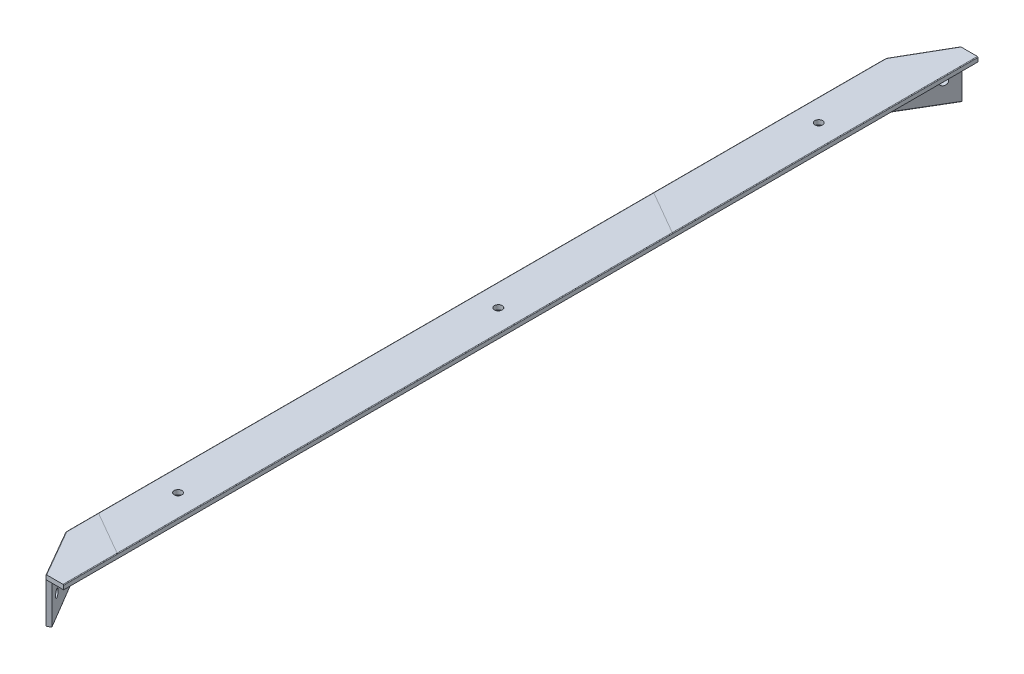
from build123d import *
from build123d.topology import SkipClean

# Parameters (mm, degrees)
BOSS_EXTRUDE1_DEPTH = 640
SKETCH22_R          = 6
CUT_EXTRUDE4_DEPTH  = 10
BOSS_EXTRUDE2_DEPTH = 63
BOSS_EXTRUDE3_DEPTH = 7
SKETCH26_R          = 6
CUT_EXTRUDE5_DEPTH  = 7
FILLET1_R           = 10
FILLET2_R           = 10
FILLET3_R           = 5
FILLET5_R           = 1


with BuildPart() as part:
    # Sketch1 → Boss-Extrude1 (new body)
    with BuildSketch(Plane.XY):
        Polygon((0, 0), (0, 70), (70, 70), (70, 63), (7, 63), (7, 0), align=None)
    extrude(amount=BOSS_EXTRUDE1_DEPTH)

    # Sketch22 → Cut-Extrude4 (cut)
    with BuildSketch(Plane(origin=(0, 70, 0), x_dir=(1, 0, 0), z_dir=(0, 1, 0))):
        with Locations((35, 0)):
            Circle(SKETCH22_R)
        with Locations((35, 500)):
            Circle(SKETCH22_R)
        with Locations((35, -500)):
            Circle(SKETCH22_R)
    extrude(amount=-CUT_EXTRUDE4_DEPTH, mode=Mode.SUBTRACT)

    # Sketch23 → Boss-Extrude2 (add)
    with BuildSketch(Plane(origin=(0, 0, 0), x_dir=(1, 0, 0), z_dir=(0, 1, 0))):
        Polygon((0, -640), (42.5, -713.612159322), (48.562177826, -710.112159322), (7, -640), align=None)
    extrude(amount=BOSS_EXTRUDE2_DEPTH)

    # Sketch25 → Boss-Extrude3 (add)
    with BuildSketch(Plane(origin=(0, 63, 0), x_dir=(1, 0, 0), z_dir=(0, 1, 0))):
        Polygon((70, -640), (0, -640), (42.5, -713.612159322), (70, -713.612159322), align=None)
    extrude(amount=BOSS_EXTRUDE3_DEPTH)

    # Sketch26 → Cut-Extrude5 (cut)
    with BuildSketch(Plane(origin=(-275.556719825, 0, 163.348804279), x_dir=(-0.5099316128113042, 0, -0.8602149442178172), z_dir=(0.8602149442178172, 0, -0.5099316128113042))):
        with Locations((-614.36248118, 31.5)):
            Circle(SKETCH26_R)
        with Locations((-575.367085589, 31.5)):
            Circle(SKETCH26_R)
    extrude(amount=-CUT_EXTRUDE5_DEPTH, mode=Mode.SUBTRACT)

    # Mirror1: part across plane


with BuildPart() as part_1:
    with SkipClean():  # the faces are left unmerged after this step: merging them gives an invalid solid
        add(part.part)
        add(part.part.mirror(Plane.XY))

    # Fillet1
    fillet1_edges = [part_1.edges().sort_by_distance(p)[0] for p in [
        (0, 35, -640),
        (0, 35, 640),
    ]]
    fillet(fillet1_edges, radius=FILLET1_R)

    # Fillet2
    fillet2_edges = [part_1.edges().sort_by_distance(p)[0] for p in [
        (7, 31.5, 640),
        (7, 31.5, -640),
    ]]
    fillet(fillet2_edges, radius=FILLET2_R)

    # Fillet3
    fillet3_edges = [part_1.edges().sort_by_distance(p)[0] for p in [
        (28.480014192, 63, 676.235112211),
        (7.355792038, 63, 639.902468471),
        (28.480014192, 63, -676.235112211),
        (7.355792038, 63, -639.902468471),
        (7, 63, 318.629374486),
    ]]
    fillet(fillet3_edges, radius=FILLET3_R)

    # Fillet5
    fillet5_edges = [part_1.edges().sort_by_distance(p)[0] for p in [
        (21.919872981, 0, 677.966333699),
        (0.340741737, 0, 639.908698527),
        (21.919872981, 0, -677.966333699),
        (0.340741737, 0, -639.908698527),
        (28.480014192, 0, 676.235112211),
        (7.355792038, 0, 639.902468471),
        (28.480014192, 0, -676.235112211),
        (7.355792038, 0, -639.902468471),
        (70, 70, 356.806079661),
        (70, 70, -356.806079661),
        (70, 70, 356.806079661),
        (21.919872981, 70, 677.966333699),
        (0.340741737, 70, 639.908698527),
        (0, 70, 318.660254038),
        (0, 70, 318.660254038),
        (0, 70, -318.660254038),
        (21.919872981, 70, -677.966333699),
        (0.340741737, 70, -639.908698527),
        (0, 0, 318.660254038),
        (7, 0, 318.629374486),
    ]]
    fillet(fillet5_edges, radius=FILLET5_R)


solid = part_1.part
